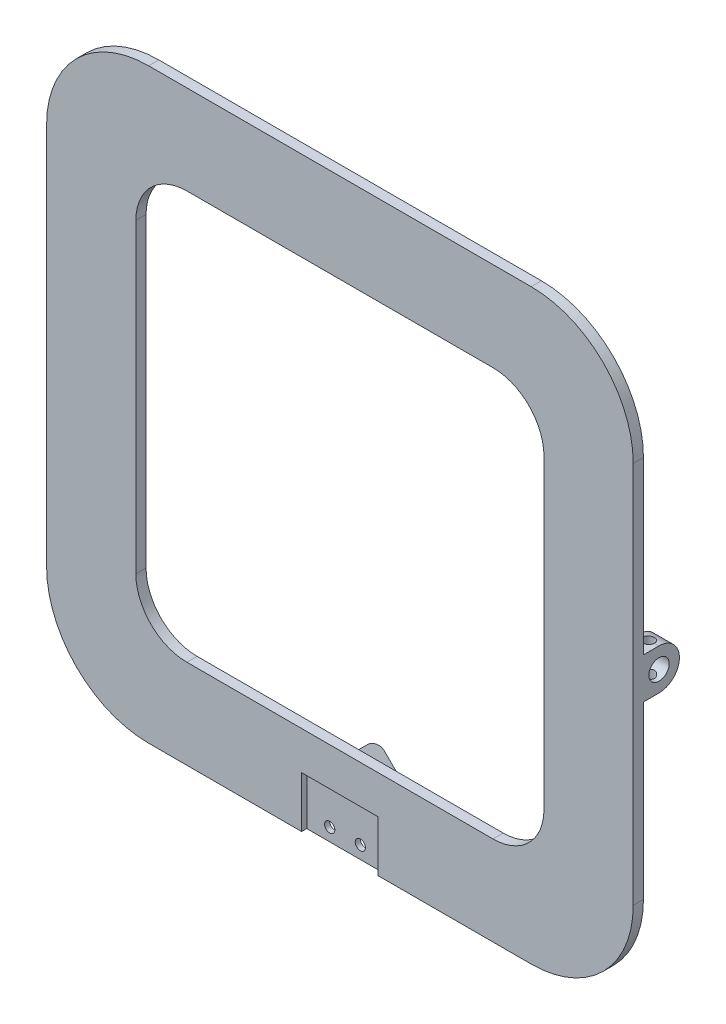
from build123d import *

# Parameters (mm, degrees)
SZKIC1_W                         = 115
SZKIC1_H                         = 115
DODANIE_WYCI_GNI_CIE1_DEPTH      = 2
DODANIE_WYCI_GNI_CIE2_DEPTH      = 4
SZKIC5_R                         = 2
WYTNIJ_WYCI_GNI_CIE1_DEPTH       = 163.787318778
SZKIC6_R                         = 1
WYTNIJ_WYCI_GNI_CIE2_DEPTH       = 10
ZAOKR_GLENIE1_R                  = 20
SZKIC7_W                         = 15
SZKIC7_H                         = 10
WYTNIJ_WYCI_GNI_CIE3_DEPTH       = 1
WYTNIJ_WYCI_GNI_CIE4_DEPTH       = 10
SZKIC9_R                         = 1.1
WYTNIJ_WYCI_GNI_CIE5_DEPTH       = 131.602301492
SZKIC10_R                        = 1.1
WYTNIJ_WYCI_GNI_CIE6_DEPTH       = 10
DODANIE_WYCI_GNI_CIE4_DEPTH      = 8
SZKIC14_W                        = 6
SZKIC14_H                        = 6
WYTNIJ_WYCI_GNI_CIE8_DEPTH       = 8
ZAOKR_GLENIE3_R                  = 2
DODANIE_WYCI_GNI_CIE5_DEPTH      = 8
SZKIC16_W                        = 6
SZKIC16_H                        = 6
WYTNIJ_WYCI_GNI_CIE9_DEPTH       = 8
ZAOKR_GLENIE5_R                  = 2
SZYK_LINIOWY1_COUNT              = 2
SZYK_LINIOWY1_PITCH              = 45
ZAOKR_GLENIE5_OF_SZYK_LINIOWY1_R = 2


with BuildPart() as part:
    # Szkic1 → Dodanie-wyciągnięcie1 (new body)
    with BuildSketch(Plane.XY):
        with Locations((57.5, -57.5)):
            Rectangle(SZKIC1_W, SZKIC1_H)
    extrude(amount=DODANIE_WYCI_GNI_CIE1_DEPTH)

    # Szkic3 → Dodanie-wyciągnięcie2 (add)
    with BuildSketch(Plane(origin=(115, 0, 0), x_dir=(0, 0, -1), z_dir=(1, 0, 0))):
        with BuildLine():
            Line((0, -53.5), (3.050613798, -53.5))
            ThreePointArc((3.050613798, -53.5), (7.050613798, -57.5), (3.050613798, -61.5))
            Line((3.050613798, -61.5), (0, -61.5))
            Line((0, -61.5), (0, -53.5))
        make_face()
    dodanie_wyci_gni_cie2 = extrude(amount=-DODANIE_WYCI_GNI_CIE2_DEPTH)

    # Lustro1: Dodanie-wyciągnięcie2 across plane
    add(dodanie_wyci_gni_cie2.mirror(Plane(origin=(57.5, 0, 0), x_dir=(0, 0, 1), z_dir=(1, 0, 0))))

    # Szkic5 → Wytnij-wyciągnięcie1 (cut, through all)
    with BuildSketch(Plane(origin=(115, 0, 0), x_dir=(0, 0, -1), z_dir=(1, 0, 0))):
        with Locations((3.050613798, -57.5)):
            Circle(SZKIC5_R)
    extrude(amount=-WYTNIJ_WYCI_GNI_CIE1_DEPTH, mode=Mode.SUBTRACT)

    # Szkic6 → Wytnij-wyciągnięcie2 (cut)
    with BuildSketch(Plane.XY.offset(2)):
        with Locations((54.5, -112.5)):
            Circle(SZKIC6_R)
        with Locations((60.5, -112.5)):
            Circle(SZKIC6_R)
    extrude(amount=-WYTNIJ_WYCI_GNI_CIE2_DEPTH, mode=Mode.SUBTRACT)

    # Zaokrąglenie1
    zaokr_glenie1_edges = [part.edges().sort_by_distance(p)[0] for p in [
        (0, -115, 1),
        (115, -115, 1),
        (0, 0, 1),
        (115, 0, 1),
    ]]
    fillet(zaokr_glenie1_edges, radius=ZAOKR_GLENIE1_R)

    # Szkic7 → Wytnij-wyciągnięcie3 (cut)
    with BuildSketch(Plane.XY.offset(2)):
        with Locations((57.5, -110)):
            Rectangle(SZKIC7_W, SZKIC7_H)
    extrude(amount=-WYTNIJ_WYCI_GNI_CIE3_DEPTH, mode=Mode.SUBTRACT)

    # Szkic8 → Wytnij-wyciągnięcie4 (cut)
    with BuildSketch(Plane(origin=(0, 0, 0), x_dir=(-1, 0, 0), z_dir=(0, 0, -1))):
        with BuildLine():
            Line((-87.5, -97.5), (-27.5, -97.5))
            ThreePointArc((-27.5, -97.5), (-20.428932188, -94.571067812), (-17.5, -87.5))
            Line((-17.5, -87.5), (-17.5, -27.5))
            ThreePointArc((-17.5, -27.5), (-20.428932188, -20.428932188), (-27.5, -17.5))
            Line((-27.5, -17.5), (-87.5, -17.5))
            ThreePointArc((-87.5, -17.5), (-94.571067812, -20.428932188), (-97.5, -27.5))
            Line((-97.5, -27.5), (-97.5, -87.5))
            ThreePointArc((-97.5, -87.5), (-94.571067812, -94.571067812), (-87.5, -97.5))
        make_face()
    extrude(amount=-WYTNIJ_WYCI_GNI_CIE4_DEPTH, mode=Mode.SUBTRACT)

    # Szkic9 → Wytnij-wyciągnięcie5 (cut, through all)
    with BuildSketch(Plane(origin=(0, -53.5, 0), x_dir=(1, 0, 0), z_dir=(0, 1, 0))):
        with Locations((2, 3.050613798)):
            Circle(SZKIC9_R)
    extrude(amount=-WYTNIJ_WYCI_GNI_CIE5_DEPTH, mode=Mode.SUBTRACT)

    # Szkic10 → Wytnij-wyciągnięcie6 (cut)
    with BuildSketch(Plane(origin=(0, -53.5, 0), x_dir=(1, 0, 0), z_dir=(0, 1, 0))):
        with Locations((113, 3.050613798)):
            Circle(SZKIC10_R)
    extrude(amount=-WYTNIJ_WYCI_GNI_CIE6_DEPTH, mode=Mode.SUBTRACT)

    # Szkic13 → Dodanie-wyciągnięcie4 (add)
    with BuildSketch(Plane(origin=(0, 0, 0), x_dir=(-1, 0, 0), z_dir=(0, 0, -1))):
        Polygon((-53.080582618, -103.598349571), (-60.151650429, -110.669417382), (-61.919417382, -108.901650429), (-54.848349571, -101.830582618), align=None)
    extrude(amount=DODANIE_WYCI_GNI_CIE4_DEPTH)

    # Szkic14 → Wytnij-wyciągnięcie8 (cut)
    with BuildSketch(Plane(origin=(-25.258883476, -25.258883476, 0), x_dir=(-0.7071067811865481, 0.707106781186547, 0), z_dir=(-0.707106781186547, -0.7071067811865481, 0))):
        with Locations((-115.788735419, 3)):
            Rectangle(SZKIC14_W, SZKIC14_H)
    extrude(amount=-WYTNIJ_WYCI_GNI_CIE8_DEPTH, mode=Mode.SUBTRACT)

    # Zaokrąglenie3
    zaokr_glenie3_edges = [part.edges().sort_by_distance(p)[0] for p in [
        (59.621320344, -108.371320344, -6),
        (55.378679656, -104.128679656, -6),
        (61.035533906, -109.785533906, -8),
        (53.964466094, -102.714466094, -8),
    ]]
    fillet(zaokr_glenie3_edges, radius=ZAOKR_GLENIE3_R)

    # Szkic15 → Dodanie-wyciągnięcie5 (add)
    with BuildSketch(Plane(origin=(0, 0, 0), x_dir=(-1, 0, 0), z_dir=(0, 0, -1))):
        Polygon((-104.697591975, -106.465358928), (-106.465358928, -104.697591975), (-99.394291117, -97.626524164), (-97.626524164, -99.394291117), align=None)
    dodanie_wyci_gni_cie5 = extrude(amount=DODANIE_WYCI_GNI_CIE5_DEPTH)

    # Szkic16 → Wytnij-wyciągnięcie9 (cut)
    with BuildSketch(Plane(origin=(-0.883883476, -0.883883476, 0), x_dir=(-0.7071067811865475, 0.7071067811865477, 0), z_dir=(-0.7071067811865477, -0.7071067811865475, 0))):
        with Locations((-144.31475452, 3)):
            Rectangle(SZKIC16_W, SZKIC16_H)
    wytnij_wyci_gni_cie9 = extrude(amount=-WYTNIJ_WYCI_GNI_CIE9_DEPTH, mode=Mode.SUBTRACT)

    # Zaokrąglenie5
    zaokr_glenie5_edges = [part.edges().sort_by_distance(p)[0] for p in [
        (99.924621202, -99.924621202, -6),
        (104.16726189, -104.16726189, -6),
        (98.51040764, -98.51040764, -8),
        (105.581475452, -105.581475452, -8),
    ]]
    fillet(zaokr_glenie5_edges, radius=ZAOKR_GLENIE5_R)

    # Szyk liniowy1: Dodanie-wyciągnięcie5, Wytnij-wyciągnięcie9 ×2
    with Locations(*[(0, i * SZYK_LINIOWY1_PITCH, 0) for i in range(1, SZYK_LINIOWY1_COUNT)]):
        add(dodanie_wyci_gni_cie5)
        add(wytnij_wyci_gni_cie9, mode=Mode.SUBTRACT)

    # Zaokrąglenie5 of Szyk liniowy1
    zaokr_glenie5_of_szyk_liniowy1_edges = [part.edges().sort_by_distance(p)[0] for p in [
        (99.924621202, -54.924621202, -6),
        (104.16726189, -59.16726189, -6),
        (98.51040764, -53.51040764, -8),
        (105.581475452, -60.581475452, -8),
    ]]
    fillet(zaokr_glenie5_of_szyk_liniowy1_edges, radius=ZAOKR_GLENIE5_OF_SZYK_LINIOWY1_R)


solid = part.part
